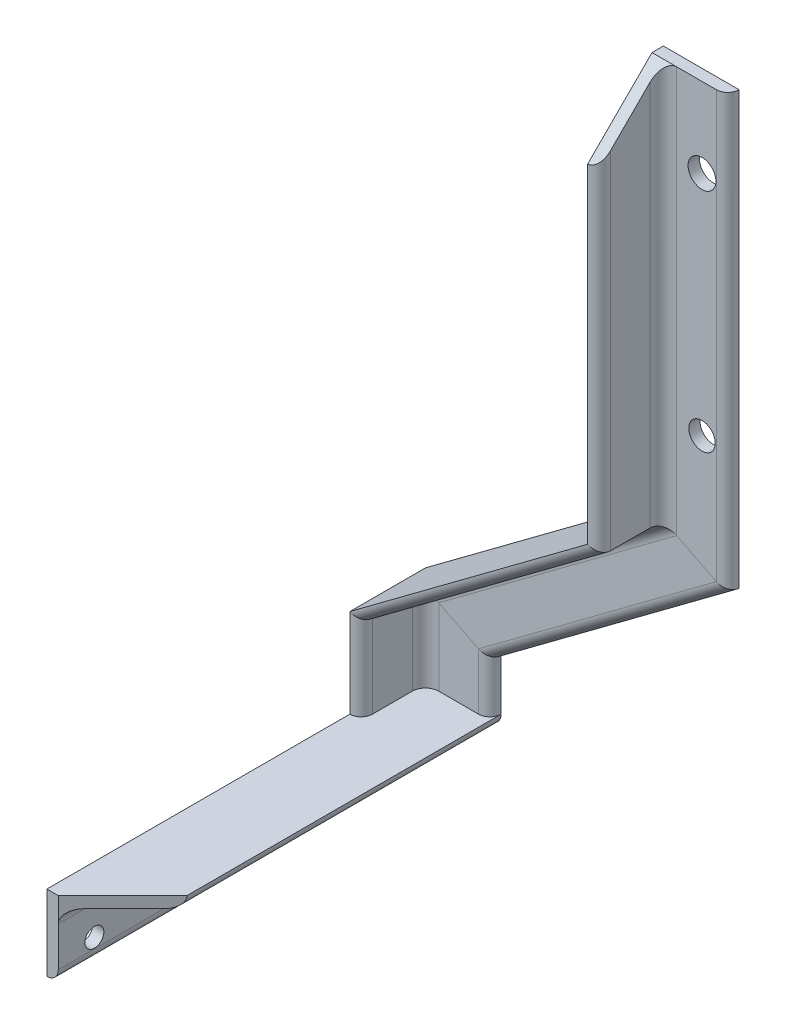
from build123d import *

# Parameters (mm, degrees)
L_START                              = 32.036415807
L_ANGLE_EQUAL_20X20X3_2_DEPTH        = 114.017108684
L_START_2                            = 64
L_ANGLE_EQUAL_20X20X3_2_2_OUTLINE_W  = 25
L_ANGLE_EQUAL_20X20X3_2_2_OUTLINE_H  = 24
L_ANGLE_EQUAL_20X20X3_2_2_DEPTH      = 10.304509974
L_START_3                            = 22.430930733
L_ANGLE_EQUAL_20X20X3_2_3_DEPTH      = 68.304556748
L_START_4                            = 12.390487258
L_ANGLE_EQUAL_20X20X3_2_4_DEPTH      = 88.385443698
L_START_5                            = -6
L_ANGLE_EQUAL_20X20X3_2_5_OUTLINE_W  = 60
L_ANGLE_EQUAL_20X20X3_2_5_OUTLINE_H  = 21
L_ANGLE_EQUAL_20X20X3_2_5_DEPTH      = 10.287337797
L_START_6                            = 74.304509974
L_ANGLE_EQUAL_20X20X3_2_6_OUTLINE_W  = 60
L_ANGLE_EQUAL_20X20X3_2_6_OUTLINE_H  = 21
L_ANGLE_EQUAL_20X20X3_2_6_DEPTH      = 9.695490026
L_START_7                            = -45.197160902
L_ANGLE_EQUAL_20X20X3_2_7_DEPTH      = 17
L_START_8                            = 1.242640687
L_ANGLE_EQUAL_20X20X3_2_8_DEPTH      = 98.757359313
L_START_9                            = 18.242640687
L_ANGLE_EQUAL_20X20X3_2_9_DEPTH      = 81.757359313
L_START_10                           = -49
L_ANGLE_EQUAL_20X20X3_2_10_DEPTH     = 22
L_START_11                           = -48.197160902
L_ANGLE_EQUAL_20X20X3_2_11_DEPTH     = 33.429444614
L_START_12                           = -14.767716288
L_ANGLE_EQUAL_20X20X3_2_12_DEPTH     = 10.040443476
L_START_13                           = 4.287337797
L_ANGLE_EQUAL_20X20X3_2_13_OUTLINE_W = 25
L_ANGLE_EQUAL_20X20X3_2_13_OUTLINE_H = 22
L_ANGLE_EQUAL_20X20X3_2_13_DEPTH     = 8.973175794
ESBO_O2_R                            = 3.5
ESBO_O2_R_2                          = 3.672679552
CORTE_EXTRUS_O1_DEPTH                = 200
ESBO_O3_R                            = 2.5
CORTE_EXTRUS_O2_DEPTH                = 10
CORTE_EXTRUS_O3_DEPTH                = 10
CORTE_EXTRUS_O4_DEPTH                = 10
CORTE_EXTRUS_O5_DEPTH                = 10
APARAR_ESTENDER4_START               = -48.197160902
APARAR_ESTENDER4_DEPTH               = 20
APARAR_ESTENDER4_2_DEPTH             = 20.621320344
CORTE_EXTRUS_O6_DEPTH                = 10


with BuildPart() as part:
    # L angle (equal) 20X20X3(2): read off the stored shape, not the designer's step
    # L angle (equal) 20X20X3(2) outline → L angle (equal) 20X20X3(2) (new body)
    with BuildSketch(Plane(origin=(0, 0, 0), x_dir=(1, 0, 0), z_dir=(0, 1, 0)).offset(L_START)):
        with BuildLine():
            Line((101.8, 0), (81.8, 0))
            Line((81.8, 0), (81.8, -20))
            ThreePointArc((81.8, -20), (83.921320344, -19.121320344), (84.8, -17))
            Line((84.8, -17), (84.8, -6.5))
            ThreePointArc((84.8, -6.5), (85.825126266, -4.025126266), (88.3, -3))
            Line((88.3, -3), (98.8, -3))
            ThreePointArc((98.8, -3), (100.921320344, -2.121320344), (101.8, 0))
        make_face()
    extrude(amount=L_ANGLE_EQUAL_20X20X3_2_DEPTH)

    # L angle _equal_ 20X20X3_2 2 outline → L angle _equal_ 20X20X3_2 2 (cut)
    with BuildSketch(Plane(origin=(0, 0, 0), x_dir=(0.8937031332908548, -0.4486587896677259, 0), z_dir=(0.4486587896677259, 0.8937031332908548, 0)).offset(L_START_2)):
        with Locations((65.5, -10)):
            Rectangle(L_ANGLE_EQUAL_20X20X3_2_2_OUTLINE_W, L_ANGLE_EQUAL_20X20X3_2_2_OUTLINE_H)
    extrude(amount=L_ANGLE_EQUAL_20X20X3_2_2_DEPTH, mode=Mode.SUBTRACT)

    # Esboço2 → Corte-extrusão1 (cut)
    with BuildSketch(Plane.XY.offset(3)):
        with Locations((95, 65)):
            Circle(ESBO_O2_R)
        with Locations((95, 125)):
            Circle(ESBO_O2_R_2)
    extrude(amount=-CORTE_EXTRUS_O1_DEPTH, mode=Mode.SUBTRACT)

    # Esboço5 → Corte-extrusão4 (cut)
    with BuildSketch(Plane.ZY.offset(-81.8)):
        Polygon((3, 146.053524491), (20, 129.053524491), (20, 146.053524491), align=None)
    extrude(amount=-CORTE_EXTRUS_O4_DEPTH, mode=Mode.SUBTRACT)


with BuildPart() as body_2:
    # L angle _equal_ 20X20X3_2 3 outline → L angle _equal_ 20X20X3_2 3 (new body)
    with BuildSketch(Plane(origin=(0, 0, 0), x_dir=(0.5974105809077824, -0.8019355322090584, 0), z_dir=(0.8019355322090584, 0.5974105809077825, 0)).offset(L_START_3)):
        with BuildLine():
            Line((35.125256976, 0), (15.125256976, 0))
            Line((15.125256976, 0), (15.125256976, -20))
            ThreePointArc((15.125256976, -20), (17.24657732, -19.121320344), (18.125256976, -17))
            Line((18.125256976, -17), (18.125256976, -6.5))
            ThreePointArc((18.125256976, -6.5), (19.150383242, -4.025126266), (21.625256976, -3))
            Line((21.625256976, -3), (32.125256976, -3))
            ThreePointArc((32.125256976, -3), (34.24657732, -2.121320344), (35.125256976, 0))
        make_face()
    extrude(amount=L_ANGLE_EQUAL_20X20X3_2_3_DEPTH)

    # L angle _equal_ 20X20X3_2 4 outline → L angle _equal_ 20X20X3_2 4 (add)
    with BuildSketch(Plane(origin=(0, 0, 0), x_dir=(0.5974105809077824, -0.8019355322090584, 0), z_dir=(0.8019355322090584, 0.5974105809077825, 0)).offset(L_START_4)):
        with BuildLine():
            Line((35.125256976, 0), (15.125256976, 0))
            Line((15.125256976, 0), (15.125256976, -20))
            ThreePointArc((15.125256976, -20), (17.24657732, -19.121320344), (18.125256976, -17))
            Line((18.125256976, -17), (18.125256976, -6.5))
            ThreePointArc((18.125256976, -6.5), (19.150383242, -4.025126266), (21.625256976, -3))
            Line((21.625256976, -3), (32.125256976, -3))
            ThreePointArc((32.125256976, -3), (34.24657732, -2.121320344), (35.125256976, 0))
        make_face()
    extrude(amount=L_ANGLE_EQUAL_20X20X3_2_4_DEPTH)

    # L angle _equal_ 20X20X3_2 5 outline → L angle _equal_ 20X20X3_2 5 (cut)
    with BuildSketch(Plane(origin=(0, 0, 0), x_dir=(0.8937031332908548, -0.4486587896677259, 0), z_dir=(0.4486587896677259, 0.8937031332908548, 0)).offset(L_START_5)):
        with Locations((48, -10.5)):
            Rectangle(L_ANGLE_EQUAL_20X20X3_2_5_OUTLINE_W, L_ANGLE_EQUAL_20X20X3_2_5_OUTLINE_H)
    extrude(amount=L_ANGLE_EQUAL_20X20X3_2_5_DEPTH, mode=Mode.SUBTRACT)

    # L angle _equal_ 20X20X3_2 6 outline → L angle _equal_ 20X20X3_2 6 (cut)
    with BuildSketch(Plane(origin=(0, 0, 0), x_dir=(0.8937031332908548, -0.4486587896677259, 0), z_dir=(0.4486587896677259, 0.8937031332908548, 0)).offset(L_START_6)):
        with Locations((48, -10.5)):
            Rectangle(L_ANGLE_EQUAL_20X20X3_2_6_OUTLINE_W, L_ANGLE_EQUAL_20X20X3_2_6_OUTLINE_H)
    extrude(amount=L_ANGLE_EQUAL_20X20X3_2_6_DEPTH, mode=Mode.SUBTRACT)


with BuildPart() as body_3:
    # L angle _equal_ 20X20X3_2 7 outline → L angle _equal_ 20X20X3_2 7 (new body)
    with BuildSketch(Plane(origin=(0, 0, 0), x_dir=(1, 0, 0), z_dir=(0, 1, 0)).offset(L_START_7)):
        Polygon((19.593680894, -20.621320344), (18.97236055, -20), (18.97236055, -100), (21.97236055, -100), (21.97236055, -18.242640687), align=None)
    extrude(amount=L_ANGLE_EQUAL_20X20X3_2_7_DEPTH)

    # L angle _equal_ 20X20X3_2 8 outline → L angle _equal_ 20X20X3_2 8 (add)
    with BuildSketch(Plane.XY.offset(L_START_8)):
        with BuildLine():
            ThreePointArc((21.97236055, -34.697160902), (22.997486816, -32.222287168), (25.47236055, -31.197160902))
            Line((25.47236055, -31.197160902), (35.97236055, -31.197160902))
            ThreePointArc((35.97236055, -31.197160902), (38.093680894, -30.318481246), (38.97236055, -28.197160902))
            Line((38.97236055, -28.197160902), (21.97236055, -28.197160902))
            Line((21.97236055, -28.197160902), (21.97236055, -34.697160902))
        make_face()
    extrude(amount=L_ANGLE_EQUAL_20X20X3_2_8_DEPTH)

    # L angle _equal_ 20X20X3_2 9 outline → L angle _equal_ 20X20X3_2 9 (add)
    with BuildSketch(Plane.XY.offset(L_START_9)):
        with BuildLine():
            ThreePointArc((18.97236055, -48.197160902), (21.093680894, -47.318481246), (21.97236055, -45.197160902))
            Line((21.97236055, -45.197160902), (18.97236055, -45.197160902))
            Line((18.97236055, -45.197160902), (18.97236055, -48.197160902))
        make_face()
    extrude(amount=L_ANGLE_EQUAL_20X20X3_2_9_DEPTH)

    # L angle _equal_ 20X20X3_2 10 outline → L angle _equal_ 20X20X3_2 10 (cut)
    with BuildSketch(Plane(origin=(0, 0, 0), x_dir=(1, 0, 0), z_dir=(0, 1, 0)).offset(L_START_10)):
        Polygon((35.97236055, -3), (36.593680894, -3.621320344), (38.97236055, -1.242640687), (21.97236055, -1.242640687), (21.97236055, -6.5), (25.47236055, -3), align=None)
        Polygon((19.593680894, -20.621320344), (21.97236055, -18.242640687), (18.97236055, -18.242640687), (18.97236055, -20), align=None)
        Polygon((22.593680894, -17.621320344), (21.97236055, -17), (21.97236055, -18.242640687), align=None)
    extrude(amount=L_ANGLE_EQUAL_20X20X3_2_10_DEPTH, mode=Mode.SUBTRACT)

    # Esboço3 → Corte-extrusão2 (cut)
    with BuildSketch(Plane(origin=(21.97236055, 0, 0), x_dir=(0, 0, -1), z_dir=(1, 0, 0))):
        with Locations((-90.460528522, -42.5)):
            Circle(ESBO_O3_R)
        with Locations((-30.460551783, -42.447167301)):
            Circle(ESBO_O3_R)
    extrude(amount=-CORTE_EXTRUS_O2_DEPTH, mode=Mode.SUBTRACT)

    # Esboço6 → Corte-extrusão5 (cut)
    with BuildSketch(Plane(origin=(0, -28.197160902, 0), x_dir=(1, 0, 0), z_dir=(0, 1, 0))):
        Polygon((21.97236055, -100), (38.97236055, -100), (38.97236055, -83), align=None)
    extrude(amount=-CORTE_EXTRUS_O5_DEPTH, mode=Mode.SUBTRACT)

    # Aparar_Estender4 2 outline → Aparar_Estender4 2 (add)
    with BuildSketch(Plane.XY):
        with BuildLine():
            ThreePointArc((35.97236055, -31.197160902), (38.093680894, -30.318481246), (38.97236055, -28.197160902))
            Line((38.97236055, -28.197160902), (18.97236055, -28.197160902))
            Line((18.97236055, -28.197160902), (18.97236055, -48.197160902))
            ThreePointArc((18.97236055, -48.197160902), (21.093680894, -47.318481246), (21.97236055, -45.197160902))
            Line((21.97236055, -45.197160902), (21.97236055, -34.697160902))
            ThreePointArc((21.97236055, -34.697160902), (22.997486816, -32.222287168), (25.47236055, -31.197160902))
            Line((25.47236055, -31.197160902), (35.97236055, -31.197160902))
        make_face()
    extrude(amount=APARAR_ESTENDER4_2_DEPTH)

    # Esboço7 → Corte-extrusão6 (cut)
    with BuildSketch(Plane.ZY.offset(-18.97236055)):
        Polygon((0, -31.197160902), (17, -48.197160902), (0, -48.197160902), align=None)
    extrude(amount=-CORTE_EXTRUS_O6_DEPTH, mode=Mode.SUBTRACT)


with BuildPart() as body_4:
    # L angle _equal_ 20X20X3_2 11 outline → L angle _equal_ 20X20X3_2 11 (new body)
    with BuildSketch(Plane(origin=(0, 0, 0), x_dir=(1, 0, 0), z_dir=(0, 1, 0)).offset(L_START_11)):
        with BuildLine():
            Line((38.97236055, 0), (18.97236055, 0))
            Line((18.97236055, 0), (18.97236055, -20))
            ThreePointArc((18.97236055, -20), (21.093680894, -19.121320344), (21.97236055, -17))
            Line((21.97236055, -17), (21.97236055, -6.5))
            ThreePointArc((21.97236055, -6.5), (22.997486816, -4.025126266), (25.47236055, -3))
            Line((25.47236055, -3), (35.97236055, -3))
            ThreePointArc((35.97236055, -3), (38.093680894, -2.121320344), (38.97236055, 0))
        make_face()
    extrude(amount=L_ANGLE_EQUAL_20X20X3_2_11_DEPTH)

    # L angle _equal_ 20X20X3_2 12 outline → L angle _equal_ 20X20X3_2 12 (add)
    with BuildSketch(Plane(origin=(0, 0, 0), x_dir=(1, 0, 0), z_dir=(0, 1, 0)).offset(L_START_12)):
        with BuildLine():
            Line((38.97236055, 0), (18.97236055, 0))
            Line((18.97236055, 0), (18.97236055, -20))
            ThreePointArc((18.97236055, -20), (21.093680894, -19.121320344), (21.97236055, -17))
            Line((21.97236055, -17), (21.97236055, -6.5))
            ThreePointArc((21.97236055, -6.5), (22.997486816, -4.025126266), (25.47236055, -3))
            Line((25.47236055, -3), (35.97236055, -3))
            ThreePointArc((35.97236055, -3), (38.093680894, -2.121320344), (38.97236055, 0))
        make_face()
    extrude(amount=L_ANGLE_EQUAL_20X20X3_2_12_DEPTH)

    # L angle _equal_ 20X20X3_2 13 outline → L angle _equal_ 20X20X3_2 13 (cut)
    with BuildSketch(Plane(origin=(0, 0, 0), x_dir=(0.8937031332908548, -0.4486587896677259, 0), z_dir=(0.4486587896677259, 0.8937031332908548, 0)).offset(L_START_13)):
        with Locations((30.5, -11)):
            Rectangle(L_ANGLE_EQUAL_20X20X3_2_13_OUTLINE_W, L_ANGLE_EQUAL_20X20X3_2_13_OUTLINE_H)
    extrude(amount=L_ANGLE_EQUAL_20X20X3_2_13_DEPTH, mode=Mode.SUBTRACT)

    # Esboço4 → Corte-extrusão3 (cut)
    with BuildSketch(Plane(origin=(0, 0, 0), x_dir=(-1, 0, 0), z_dir=(0, 0, -1))):
        Polygon((-21.97236055, -48.197160902), (-38.97236055, -31.197160902), (-38.97236055, -48.197160902), align=None)
    extrude(amount=-CORTE_EXTRUS_O3_DEPTH, mode=Mode.SUBTRACT)

    # Aparar/Estender4: read off the stored shape, not the designer's step
    # Aparar/Estender4 outline → Aparar/Estender4 (cut)
    with BuildSketch(Plane(origin=(0, 0, 0), x_dir=(1, 0, 0), z_dir=(0, 1, 0)).offset(APARAR_ESTENDER4_START)):
        with BuildLine():
            Line((38.97236055, 0), (18.97236055, 0))
            Line((18.97236055, 0), (18.97236055, -20))
            ThreePointArc((18.97236055, -20), (21.093680894, -19.121320344), (21.97236055, -17))
            Line((21.97236055, -17), (21.97236055, -6.5))
            ThreePointArc((21.97236055, -6.5), (22.997486816, -4.025126266), (25.47236055, -3))
            Line((25.47236055, -3), (35.97236055, -3))
            ThreePointArc((35.97236055, -3), (38.093680894, -2.121320344), (38.97236055, 0))
        make_face()
    extrude(amount=APARAR_ESTENDER4_DEPTH, mode=Mode.SUBTRACT)


solid = Compound([part.part, body_2.part, body_3.part, body_4.part])
